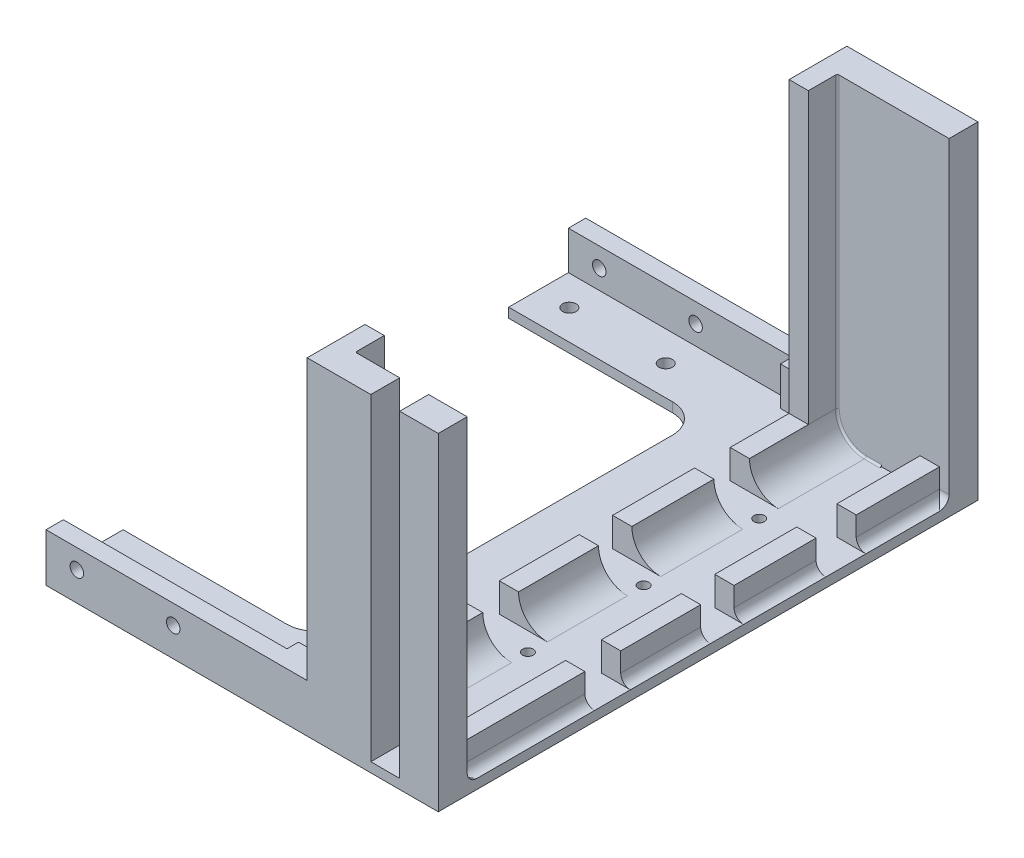
from build123d import *

# Parameters (mm, degrees)
BOSS_EXTRUDE1_DEPTH      = 250
BOSS_EXTRUDE2_DEPTH      = 50
BOSS_EXTRUDE2_2_DEPTH    = 50
LPATTERN1_COUNT          = 4
LPATTERN1_PITCH          = 60
SKETCH2_R                = 2.75
CUT_EXTRUDE1_DEPTH       = 251.864711302
UPPER_ACRYLIC_SUPP_W     = 20
UPPER_ACRYLIC_SUPP_H     = 250
BOSS_EXTRUDE3_DEPTH      = 5
UPPER_ACRYLIC_SUPP_3_W   = 10
UPPER_ACRYLIC_SUPP_3_H   = 66.073604859
UPPER_ACRYLIC_SUPP_3_H_2 = 41.475217291
UPPER_ACRYLIC_SUPP_3_H_3 = 42.557179481
UPPER_ACRYLIC_SUPP_3_H_4 = 45.558340935
BOSS_EXTRUDE4_DEPTH      = 15
FILLET1_R                = 15
SKETCH4_W                = 60
SKETCH4_H                = 15
BOSS_EXTRUDE5_DEPTH      = 5
SKETCH4_3_W              = 60
SKETCH4_3_H              = 15
BOSS_EXTRUDE6_DEPTH      = 60
SKETCH5_W                = 10
SKETCH5_H                = 45
BOSS_EXTRUDE7_DEPTH      = 15
BOSS_EXTRUDE8_START      = 250
SKETCH5_3_W              = 10
SKETCH5_3_H              = 45
BOSS_EXTRUDE8_DEPTH      = 15
FILLET2_R                = 1
SKETCH6_W                = 6
SKETCH6_H                = 60
CUT_EXTRUDE2_DEPTH       = 6
BOSS_EXTRUDE9_DEPTH      = 30
SKETCH8_W                = 333.602701612
SKETCH8_H                = 59.031331047
CUT_EXTRUDE3_DEPTH       = 150
SKETCH9_W                = 6
SKETCH9_H                = 20
CLOTH_ESCAPE_GAP_DEPTH   = 20
SKETCH11_W               = 9
SKETCH11_H               = 20
BOSS_EXTRUDE11_DEPTH     = 100
CUT_EXTRUDE4_DEPTH       = 68
SKETCH13_W               = 40
SKETCH13_H               = 5
BOSS_EXTRUDE13_DEPTH     = 100
CUT_EXTRUDE5_DEPTH       = 100
FILLET3_R                = 15
BOSS_EXTRUDE14_START     = -5
BOSS_EXTRUDE14_DEPTH     = 25
CUT_EXTRUDE6_DEPTH       = 30
CUT_EXTRUDE6_DEPTH_BACK  = 10
SKETCH16_5_W             = 8.5
SKETCH16_5_H             = 41.475217291
SKETCH16_5_H_2           = 42.557179481
SKETCH16_5_W_2           = 1.5
SKETCH16_5_H_3           = 42.177819043
SKETCH16_5_H_4           = 20.831100018
SKETCH16_5_H_5           = 17.311395043
SKETCH16_5_H_6           = 18.573684265
SKETCH16_5_H_7           = 65.073604859
SKETCH16_6_W             = 8.5
SKETCH16_6_H             = 41.475217291
SKETCH16_6_H_2           = 42.557179481
SKETCH16_6_W_2           = 1.5
SKETCH16_6_H_3           = 42.177819043
SKETCH16_6_H_4           = 20.831100018
SKETCH16_6_H_5           = 17.311395043
SKETCH16_6_H_6           = 18.573684265
SKETCH16_6_H_7           = 65.073604859
BOSS_EXTRUDE15_DEPTH     = 5
BOSS_EXTRUDE16_DEPTH     = 20
SKETCH16_8_W             = 8.5
SKETCH16_8_H             = 41.475217291
SKETCH16_8_H_2           = 42.557179481
SKETCH16_8_W_2           = 1.5
SKETCH16_8_H_3           = 42.177819043
SKETCH16_8_H_4           = 65.073604859
BOSS_EXTRUDE17_DEPTH     = 15
BOSS_EXTRUDE18_START     = -5
BOSS_EXTRUDE18_DEPTH     = 25
FILLET4_R                = 5
BOSS_EXTRUDE21_START     = 145
BOSS_EXTRUDE21_DEPTH     = 170
SKETCH19_R               = 3.5
CUT_EXTRUDE7_DEPTH       = 10
CUT_EXTRUDE8_DEPTH       = 355
CUT_EXTRUDE8_DEPTH_BACK  = 10
SKETCH20_R               = 3.5
SKETCH21_W               = 15
SKETCH21_H               = 197.501027769
CUT_EXTRUDE9_DEPTH       = 340


with BuildPart() as part:
    # profile → Boss-Extrude1 (new body)
    with BuildSketch(Plane.XY):
        Polygon((-14.746446609, 10.353553391), (-5.253553391, 10.353553391), (5.667330529, 10.353553391), (14.746446609, 10.353553391), (20, 10.353553391), (20, 15.353553391), (-20, 15.353553391), (-20, 10.353553391), align=None)
    extrude(amount=BOSS_EXTRUDE1_DEPTH)

    # Sketch2 → Cut-Extrude1 (cut, through all)
    with BuildSketch(Plane.XZ.offset(-10.353553391)):
        with Locations(Location((-10, 175, 0), (0, 0, 270))):
            Circle(SKETCH2_R)
        with Locations(Location((10, 175, 0), (0, 0, 270))):
            Circle(SKETCH2_R)
        with Locations(Location((-10, 115, 0), (0, 0, 270))):
            Circle(SKETCH2_R)
        with Locations(Location((10, 115, 0), (0, 0, 270))):
            Circle(SKETCH2_R)
        with Locations(Location((-10, 55, 0), (0, 0, 270))):
            Circle(SKETCH2_R)
        with Locations(Location((10, 55, 0), (0, 0, 270))):
            Circle(SKETCH2_R)
    extrude(amount=-CUT_EXTRUDE1_DEPTH, mode=Mode.SUBTRACT)

    # upper_acrylic_supp → Boss-Extrude3 (add)
    with BuildSketch(Plane(origin=(0, 15.353553391, 0), x_dir=(1, 0, 0), z_dir=(0, 1, 0))):
        with Locations((-30, -125)):
            Rectangle(UPPER_ACRYLIC_SUPP_W, UPPER_ACRYLIC_SUPP_H)
    extrude(amount=-BOSS_EXTRUDE3_DEPTH)

    # upper_acrylic_supp<3> → Boss-Extrude4 (add)
    with BuildSketch(Plane(origin=(0, 15.353553391, 0), x_dir=(1, 0, 0), z_dir=(0, 1, 0))):
        with Locations((-29.5, -216.963197571)):
            Rectangle(UPPER_ACRYLIC_SUPP_3_W, UPPER_ACRYLIC_SUPP_3_H)
        with Locations((-29.5, -144.615102231)):
            Rectangle(UPPER_ACRYLIC_SUPP_3_W, UPPER_ACRYLIC_SUPP_3_H_2)
        with Locations((-29.5, -85.287508801)):
            Rectangle(UPPER_ACRYLIC_SUPP_3_W, UPPER_ACRYLIC_SUPP_3_H_3)
        with Locations((-29.5, -22.779170468)):
            Rectangle(UPPER_ACRYLIC_SUPP_3_W, UPPER_ACRYLIC_SUPP_3_H_4)
    extrude(amount=BOSS_EXTRUDE4_DEPTH)

    # Fillet1
    fillet1_edges = [part.edges().sort_by_distance(p)[0] for p in [
        (-24.5, 15.353553391, 22.779170467),
        (-24.5, 15.353553391, 85.287508801),
        (-24.5, 15.353553391, 144.615102231),
        (-24.5, 15.353553391, 216.963197571),
    ]]
    fillet(fillet1_edges, radius=FILLET1_R - 0.0001)  # a hair under: the kernel refuses the full size



with BuildPart() as body_2:
    # Sketch1<3> → Boss-Extrude2 (new body)
    with BuildSketch(Plane.XY):
        Polygon((-7.253553391, 8.353553391), (-8.119669914, 7.487436867), (-5.5, 7.487436867), (-4.987436867, 7.487436867), (-5.5, 6.974873734), (-7.874873734, 4.6), (-12.125126266, 4.6), (-14.5, 6.974873734), (-15.012563133, 7.487436867), (-14.5, 7.487436867), (-11.880330086, 7.487436867), (-12.746446609, 8.353553391), (-14.746446609, 10.353553391), (-5.253553391, 10.353553391), align=None)
    boss_extrude2 = extrude(amount=BOSS_EXTRUDE2_DEPTH)


with BuildPart() as body_3:
    # Sketch1<3> → Boss-Extrude2 2 (new body)
    with BuildSketch(Plane.XY):
        Polygon((12.746446609, 8.353553391), (11.880330086, 7.487436867), (14.5, 7.487436867), (15.012563133, 7.487436867), (14.5, 6.974873734), (12.125126266, 4.6), (7.874873734, 4.6), (5.5, 6.974873734), (4.987436867, 7.487436867), (5.5, 7.487436867), (8.533447053, 7.487436867), (7.667330529, 8.353553391), (5.667330529, 10.353553391), (14.746446609, 10.353553391), align=None)
    boss_extrude2_2 = extrude(amount=BOSS_EXTRUDE2_2_DEPTH)


with BuildPart() as lpattern1_1:
    # LPattern1: Boss-Extrude2, Boss-Extrude2 2 ×4
    with Locations(*[(0, 0, i * LPATTERN1_PITCH) for i in range(1, LPATTERN1_COUNT)]):
        add(boss_extrude2)
        add(boss_extrude2_2)


with BuildPart() as part_1:
    add(part.part)

    add(body_2.part)  # Boss-Extrude5 merges body 2

    add(body_3.part)  # Boss-Extrude5 merges body 3
    # Sketch4 → Boss-Extrude5 (add, symmetric)
    with BuildSketch(Plane(origin=(0, 15.353553391, 0), x_dir=(1, 0, 0), z_dir=(0, 1, 0))):
        with Locations((-10, -257.5)):
            Rectangle(SKETCH4_W, SKETCH4_H)
        with Locations((-10, 7.5)):
            Rectangle(SKETCH4_W, SKETCH4_H)
    extrude(amount=BOSS_EXTRUDE5_DEPTH, both=True)

    # Sketch4<3> → Boss-Extrude6 (add)
    with BuildSketch(Plane(origin=(0, 15.353553391, 0), x_dir=(1, 0, 0), z_dir=(0, 1, 0))):
        with Locations((-10, -257.5)):
            Rectangle(SKETCH4_3_W, SKETCH4_3_H)
        with Locations((-10, 7.5)):
            Rectangle(SKETCH4_3_W, SKETCH4_3_H)
    extrude(amount=BOSS_EXTRUDE6_DEPTH)

    # Sketch5 → Boss-Extrude7 (add)
    with BuildSketch(Plane(origin=(0, 0, 250), x_dir=(-1, 0, 0), z_dir=(0, 0, -1))):
        with Locations((29.5, 52.853553391)):
            Rectangle(SKETCH5_W, SKETCH5_H)
    extrude(amount=BOSS_EXTRUDE7_DEPTH)

    # Sketch5<3> → Boss-Extrude8 (add)
    with BuildSketch(Plane(origin=(0, 0, 250), x_dir=(-1, 0, 0), z_dir=(0, 0, -1)).offset(BOSS_EXTRUDE8_START)):
        with Locations((29.5, 52.853553391)):
            Rectangle(SKETCH5_3_W, SKETCH5_3_H)
    extrude(amount=-BOSS_EXTRUDE8_DEPTH)

    # Fillet2
    fillet2_edges = [part_1.edges().sort_by_distance(p)[0] for p in [
        (-24.5, 52.853503391, 250),
        (-24.5, 52.853503391, 0),
        (5.24995, 15.353553391, 250),
        (-20.106631007, 19.746922384, 250),
        (-20.106631007, 19.746922384, 0),
        (5.24995, 15.353553391, 0),
    ]]
    fillet(fillet2_edges, radius=FILLET2_R)

    # Sketch6 → Cut-Extrude2 (cut)
    with BuildSketch(Plane.ZY.offset(40)):
        with Locations((253, 45.353553391)):
            Rectangle(SKETCH6_W, SKETCH6_H)
        with Locations((-3, 45.353553391)):
            Rectangle(SKETCH6_W, SKETCH6_H)
    extrude(amount=-CUT_EXTRUDE2_DEPTH, mode=Mode.SUBTRACT)

    # Sketch7 → Boss-Extrude9 (add)
    with BuildSketch(Plane.ZY.offset(40)):
        Polygon((265, 75.353553391), (256, 75.353553391), (256, 15.353553391), (-6, 15.353553391), (-6, 75.353553391), (-15, 75.353553391), (-15, 10.353553391), (265, 10.353553391), align=None)
    extrude(amount=BOSS_EXTRUDE9_DEPTH)

    # Sketch8 → Cut-Extrude3 (cut)
    with BuildSketch(Plane.ZY.offset(70)):
        with Locations((122.426839416, 64.869218915)):
            Rectangle(SKETCH8_W, SKETCH8_H)
    extrude(amount=-CUT_EXTRUDE3_DEPTH, mode=Mode.SUBTRACT)

    # Sketch9 → cloth_escape_gap (add)
    with BuildSketch(Plane.ZY.offset(34)):
        with Locations((253, 25.353553391)):
            Rectangle(SKETCH9_W, SKETCH9_H)
        with Locations((-3, 25.353553391)):
            Rectangle(SKETCH9_W, SKETCH9_H)
    extrude(amount=CLOTH_ESCAPE_GAP_DEPTH)

    # Sketch11 → Boss-Extrude11 (add)
    with BuildSketch(Plane.ZY.offset(70)):
        with Locations((-10.5, 25.353553391)):
            Rectangle(SKETCH11_W, SKETCH11_H)
        with Locations((260.5, 25.353553391)):
            Rectangle(SKETCH11_W, SKETCH11_H)
    extrude(amount=BOSS_EXTRUDE11_DEPTH)

    # Sketch12 → Cut-Extrude4 (cut)
    with BuildSketch(Plane.XZ.offset(-10.353553391)):
        Polygon((-170, 265), (-70, 265), (-170, 260.5), align=None)
        Polygon((-70, -15), (-170, -10.5), (-170, -15), align=None)
    extrude(amount=-CUT_EXTRUDE4_DEPTH, mode=Mode.SUBTRACT)

    # Sketch13 → Boss-Extrude13 (add)
    with BuildSketch(Plane.ZY.offset(70)):
        with Locations((5, 12.853553391)):
            Rectangle(SKETCH13_W, SKETCH13_H)
        with Locations((245, 12.853553391)):
            Rectangle(SKETCH13_W, SKETCH13_H)
    extrude(amount=BOSS_EXTRUDE13_DEPTH)

    # Sketch14 → Cut-Extrude5 (cut)
    with BuildSketch(Plane(origin=(0, 15.353553391, 0), x_dir=(1, 0, 0), z_dir=(0, 1, 0))):
        Polygon((-70, -265), (-170, -260.5), (-170, -265), align=None)
        Polygon((-170, 15), (-170, 10.5), (-70, 15), align=None)
    extrude(amount=-CUT_EXTRUDE5_DEPTH, mode=Mode.SUBTRACT)

    # Fillet3
    fillet3_edges = [part_1.edges().sort_by_distance(p)[0] for p in [
        (-70, 12.853553391, 25),
        (-70, 12.853553391, 225),
    ]]
    fillet(fillet3_edges, radius=FILLET3_R)

    # Sketch16 → Boss-Extrude14 (add)
    with BuildSketch(Plane(origin=(0, 15.353553391, 0), x_dir=(1, 0, 0), z_dir=(0, 1, 0)).offset(BOSS_EXTRUDE14_START)):
        Polygon((28.5, 0), (33.5, 0), (33.5, 15), (18.5, 15), (18.5, 0), align=None)
        Polygon((18.5, -250), (18.5, -265), (33.5, -265), (33.5, -250), (28.5, -250), align=None)
    extrude(amount=BOSS_EXTRUDE14_DEPTH)

    # Sketch16<5> → Cut-Extrude6 (cut, two sides: drawn at the far end of the back side and taken through both)
    with BuildSketch(Plane(origin=(0, 15.353553391, 0), x_dir=(1, 0, 0), z_dir=(0, 1, 0)).offset(-CUT_EXTRUDE6_DEPTH_BACK)):
        Polygon((18.5, -250), (18.5, -265), (33.5, -265), (33.5, -250), (28.5, -250), align=None)
        Polygon((28.5, -250), (33.5, -250), (33.5, 0), (28.5, 0), (28.5, -43.177819043), (20, -43.177819043), (20, -64.008919061), (28.5, -64.008919061), (28.5, -106.566098542), (20, -106.566098542), (20, -123.877493585), (28.5, -123.877493585), (28.5, -165.352710876), (20, -165.352710876), (20, -183.926395141), (28.5, -183.926395141), align=None)
        with Locations((24.25, -144.615102231)):
            Rectangle(SKETCH16_5_W, SKETCH16_5_H)
        with Locations((24.25, -85.287508801)):
            Rectangle(SKETCH16_5_W, SKETCH16_5_H_2)
        Polygon((28.5, -43.177819043), (28.5, 0), (18.5, 0), (18.5, -1), (20, -1), (20, -43.177819043), align=None)
        Polygon((28.5, 0), (33.5, 0), (33.5, 15), (18.5, 15), (18.5, 0), align=None)
        with Locations((19.25, -22.088909521)):
            Rectangle(SKETCH16_5_W_2, SKETCH16_5_H_3)
        with Locations((19.25, -53.593369052)):
            Rectangle(SKETCH16_5_W_2, SKETCH16_5_H_4)
        with Locations((19.25, -85.287508801)):
            Rectangle(SKETCH16_5_W_2, SKETCH16_5_H_2)
        with Locations((19.25, -115.221796064)):
            Rectangle(SKETCH16_5_W_2, SKETCH16_5_H_5)
        with Locations((19.25, -144.615102231)):
            Rectangle(SKETCH16_5_W_2, SKETCH16_5_H)
        with Locations((19.25, -174.639553009)):
            Rectangle(SKETCH16_5_W_2, SKETCH16_5_H_6)
        with Locations((19.25, -216.463197571)):
            Rectangle(SKETCH16_5_W_2, SKETCH16_5_H_7)
        Polygon((18.5, -249), (18.5, -250), (28.5, -250), (28.5, -183.926395141), (20, -183.926395141), (20, -249), align=None)
    extrude(amount=CUT_EXTRUDE6_DEPTH + CUT_EXTRUDE6_DEPTH_BACK, mode=Mode.SUBTRACT)

    # Sketch16<6> → Boss-Extrude15 (add)
    with BuildSketch(Plane(origin=(0, 15.353553391, 0), x_dir=(1, 0, 0), z_dir=(0, 1, 0))):
        Polygon((28.5, -250), (33.5, -250), (33.5, 0), (28.5, 0), (28.5, -43.177819043), (20, -43.177819043), (20, -64.008919061), (28.5, -64.008919061), (28.5, -106.566098542), (20, -106.566098542), (20, -123.877493585), (28.5, -123.877493585), (28.5, -165.352710876), (20, -165.352710876), (20, -183.926395141), (28.5, -183.926395141), align=None)
        Polygon((18.5, -249), (18.5, -250), (28.5, -250), (28.5, -183.926395141), (20, -183.926395141), (20, -249), align=None)
        Polygon((18.5, -250), (18.5, -265), (33.5, -265), (33.5, -250), (28.5, -250), align=None)
        with Locations((24.25, -144.615102231)):
            Rectangle(SKETCH16_6_W, SKETCH16_6_H)
        with Locations((24.25, -85.287508801)):
            Rectangle(SKETCH16_6_W, SKETCH16_6_H_2)
        Polygon((28.5, -43.177819043), (28.5, 0), (18.5, 0), (18.5, -1), (20, -1), (20, -43.177819043), align=None)
        Polygon((28.5, 0), (33.5, 0), (33.5, 15), (18.5, 15), (18.5, 0), align=None)
        with Locations((19.25, -22.088909521)):
            Rectangle(SKETCH16_6_W_2, SKETCH16_6_H_3)
        with Locations((19.25, -53.593369052)):
            Rectangle(SKETCH16_6_W_2, SKETCH16_6_H_4)
        with Locations((19.25, -85.287508801)):
            Rectangle(SKETCH16_6_W_2, SKETCH16_6_H_2)
        with Locations((19.25, -115.221796064)):
            Rectangle(SKETCH16_6_W_2, SKETCH16_6_H_5)
        with Locations((19.25, -144.615102231)):
            Rectangle(SKETCH16_6_W_2, SKETCH16_6_H)
        with Locations((19.25, -174.639553009)):
            Rectangle(SKETCH16_6_W_2, SKETCH16_6_H_6)
        with Locations((19.25, -216.463197571)):
            Rectangle(SKETCH16_6_W_2, SKETCH16_6_H_7)
    extrude(amount=-BOSS_EXTRUDE15_DEPTH)

    # Sketch16<7> → Boss-Extrude16 (add)
    with BuildSketch(Plane(origin=(0, 15.353553391, 0), x_dir=(1, 0, 0), z_dir=(0, 1, 0))):
        Polygon((18.5, -250), (18.5, -265), (33.5, -265), (33.5, -250), (28.5, -250), align=None)
        Polygon((28.5, 0), (33.5, 0), (33.5, 15), (18.5, 15), (18.5, 0), align=None)
    extrude(amount=BOSS_EXTRUDE16_DEPTH)

    # Sketch16<8> → Boss-Extrude17 (add)
    with BuildSketch(Plane(origin=(0, 15.353553391, 0), x_dir=(1, 0, 0), z_dir=(0, 1, 0))):
        Polygon((18.5, -249), (18.5, -250), (28.5, -250), (28.5, -183.926395141), (20, -183.926395141), (20, -249), align=None)
        with Locations((24.25, -144.615102231)):
            Rectangle(SKETCH16_8_W, SKETCH16_8_H)
        with Locations((24.25, -85.287508801)):
            Rectangle(SKETCH16_8_W, SKETCH16_8_H_2)
        Polygon((28.5, -43.177819043), (28.5, 0), (18.5, 0), (18.5, -1), (20, -1), (20, -43.177819043), align=None)
        with Locations((19.25, -22.088909521)):
            Rectangle(SKETCH16_8_W_2, SKETCH16_8_H_3)
        with Locations((19.25, -85.287508801)):
            Rectangle(SKETCH16_8_W_2, SKETCH16_8_H_2)
        with Locations((19.25, -144.615102231)):
            Rectangle(SKETCH16_8_W_2, SKETCH16_8_H)
        with Locations((19.25, -216.463197571)):
            Rectangle(SKETCH16_8_W_2, SKETCH16_8_H_4)
    extrude(amount=BOSS_EXTRUDE17_DEPTH)

    # Sketch14<2> → Boss-Extrude18 (add)
    with BuildSketch(Plane(origin=(0, 15.353553391, 0), x_dir=(1, 0, 0), z_dir=(0, 1, 0)).offset(BOSS_EXTRUDE18_START)):
        Polygon((-70, -265), (-170, -260.5), (-170, -265), align=None)
        Polygon((-170, 15), (-170, 10.5), (-70, 15), align=None)
    extrude(amount=BOSS_EXTRUDE18_DEPTH)

    # Fillet4
    fillet4_edges = [part_1.edges().sort_by_distance(p)[0] for p in [
        (31, 15.353553391, 0),
        (28.5, 15.353553391, 21.588909521),
        (28.5, 15.353553391, 85.287508801),
        (28.5, 15.353553391, 144.615102231),
        (31, 15.353553391, 250),
        (28.5, 15.353553391, 216.963197571),
    ]]
    fillet(fillet4_edges, radius=FILLET4_R - 0.0001)  # a hair under: the kernel refuses the full size

    # Sketch18 → Boss-Extrude21 (add)
    with BuildSketch(Plane(origin=(0, 35.353553391, 0), x_dir=(1, 0, 0), z_dir=(0, 1, 0)).offset(BOSS_EXTRUDE21_START)):
        with BuildLine():
            Line((-34.5, -250), (-34.5, -265))
            Line((-34.5, -265), (33.5, -265))
            Line((33.5, -265), (33.5, -250))
            Line((33.5, -250), (-23.5, -250))
            ThreePointArc((-23.5, -250), (-24.207106781, -249.707106781), (-24.5, -249))
            Line((-24.5, -249), (-24.5, -235))
            Line((-24.5, -235), (-34.5, -235))
            Line((-34.5, -235), (-34.5, -250))
        make_face()
        with BuildLine():
            Line((-34.5, 15), (-34.5, 0))
            Line((-34.5, 0), (-34.5, -15))
            Line((-34.5, -15), (-24.5, -15))
            Line((-24.5, -15), (-24.5, -1))
            ThreePointArc((-24.5, -1), (-24.207106781, -0.292893219), (-23.5, 0))
            Line((-23.5, 0), (33.5, 0))
            Line((33.5, 0), (33.5, 15))
            Line((33.5, 15), (-34.5, 15))
        make_face()
    extrude(amount=-BOSS_EXTRUDE21_DEPTH)

    # Sketch19 → Cut-Extrude7 (cut)
    with BuildSketch(Plane(origin=(0, 15.353553391, 0), x_dir=(1, 0, 0), z_dir=(0, 1, 0))):
        with Locations(Location((-154, -9.5, 0), (0, 0, 270))):
            Circle(SKETCH19_R)
        with Locations(Location((-104, -9.5, 0), (0, 0, 270))):
            Circle(SKETCH19_R)
        with Locations(Location((-104, -240.5, 0), (0, 0, 270))):
            Circle(SKETCH19_R)
        with Locations(Location((-154, -240.5, 0), (0, 0, 270))):
            Circle(SKETCH19_R)
    extrude(amount=-CUT_EXTRUDE7_DEPTH, mode=Mode.SUBTRACT)

    # Sketch20 → Cut-Extrude8 (cut, two sides: drawn at the far end of the back side and taken through both)
    with BuildSketch(Plane(origin=(0, 0, 256), x_dir=(-1, 0, 0), z_dir=(0, 0, -1)).offset(-CUT_EXTRUDE8_DEPTH_BACK)):
        with Locations(Location((104, 25.353553391, 0), (0, 0, 180))):
            Circle(SKETCH20_R)
        with Locations(Location((154, 25.353553391, 0), (0, 0, 180))):
            Circle(SKETCH20_R)
    extrude(amount=CUT_EXTRUDE8_DEPTH + CUT_EXTRUDE8_DEPTH_BACK, mode=Mode.SUBTRACT)

    # Sketch21 → Cut-Extrude9 (cut)
    with BuildSketch(Plane.XY):
        with Locations((6, 114.104067276)):
            Rectangle(SKETCH21_W, SKETCH21_H)
    extrude(amount=CUT_EXTRUDE9_DEPTH, mode=Mode.SUBTRACT)


solid = Compound([lpattern1_1.part, part_1.part])
